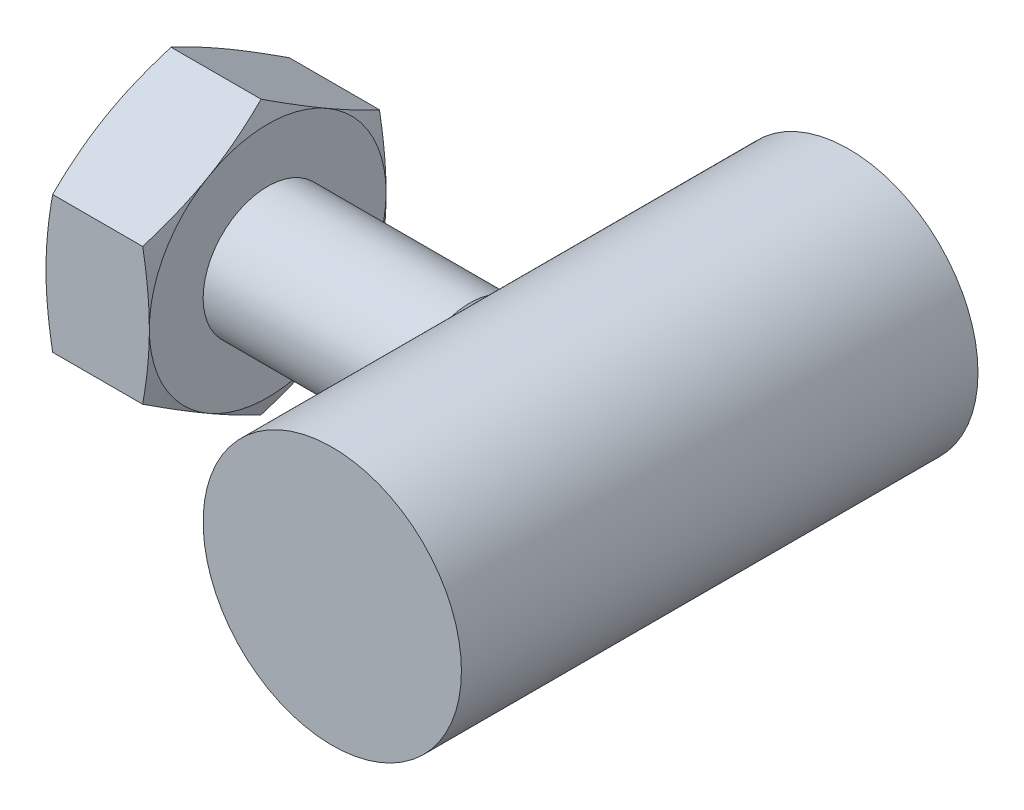
from build123d import *

# Parameters (mm, degrees)
SKETCH1_W          = 12
SKETCH1_H          = 3
SKETCH4_W          = 11
SKETCH4_H          = 11
CUT_EXTRUDE1_DEPTH = 2.4


with BuildPart() as part:
    # Sketch1 → Revolve1 (revolve)
    with BuildSketch(Plane(origin=(0, 0, 0), x_dir=(0, 0, -1), z_dir=(1, 0, 0))):
        with Locations((0, 1.5)):
            Rectangle(SKETCH1_W, SKETCH1_H)
    revolve(axis=Axis((0, 0, -6), (0, 0, 1)))

    # Sketch2 → Revolve2 (revolve)
    with BuildSketch(Plane.XY):
        Polygon((-10, 0), (-10, 1.1935), (-9.6935, 1.5), (-2.8065, 1.5), (-2.5, 1.1935), (-2.5, 0), align=None)
    revolve(axis=Axis((-2.5, 0, 0), (-1, 0, 0)))

    # Sketch3 → Revolve3 (revolve)
    with BuildSketch(Plane.XY):
        Polygon((-9.9, 2.75), (-9.9, 1.5), (-7.5, 1.5), (-7.5, 2.75), (-7.654842576, 3.175426481), (-9.745157424, 3.175426481), align=None)
    revolve(axis=Axis((42.5, 0, 0), (-1, 0, 0)))

    # Sketch4 → Cut-Extrude1 (cut)
    with BuildSketch(Plane(origin=(-7.5, 0, 0), x_dir=(0, 0, -1), z_dir=(1, 0, 0))):
        Rectangle(SKETCH4_W, SKETCH4_H)
        Polygon((-2.75, -1.58771324), (0, -3.175426481), (2.75, -1.58771324), (2.75, 1.58771324), (0, 3.175426481), (-2.75, 1.58771324), align=None, mode=Mode.SUBTRACT)
    extrude(amount=-CUT_EXTRUDE1_DEPTH, mode=Mode.SUBTRACT)


solid = part.part
